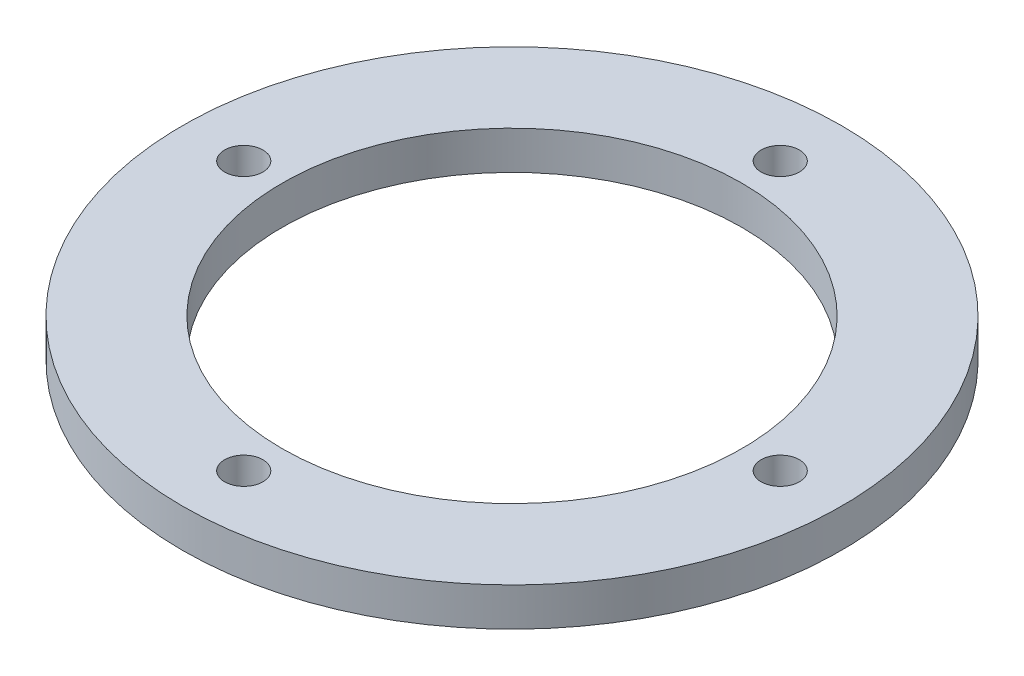
from build123d import *

# Parameters (mm, degrees)
SKETCH1_R           = 43
SKETCH1_R_2         = 2.5
SKETCH1_R_3         = 30
BOSS_EXTRUDE1_DEPTH = 5


with BuildPart() as part:
    # Sketch1 → Boss-Extrude1 (new body)
    with BuildSketch(Plane(origin=(0, 0, 0), x_dir=(1, 0, 0), z_dir=(0, 1, 0))):
        Circle(SKETCH1_R)
        with Locations((-35, 0)):
            Circle(SKETCH1_R_2, mode=Mode.SUBTRACT)
        with Locations((0, 35)):
            Circle(SKETCH1_R_2, mode=Mode.SUBTRACT)
        with Locations((35, 0)):
            Circle(SKETCH1_R_2, mode=Mode.SUBTRACT)
        with Locations((0, -35)):
            Circle(SKETCH1_R_2, mode=Mode.SUBTRACT)
        Circle(SKETCH1_R_3, mode=Mode.SUBTRACT)
    extrude(amount=BOSS_EXTRUDE1_DEPTH)


solid = part.part
